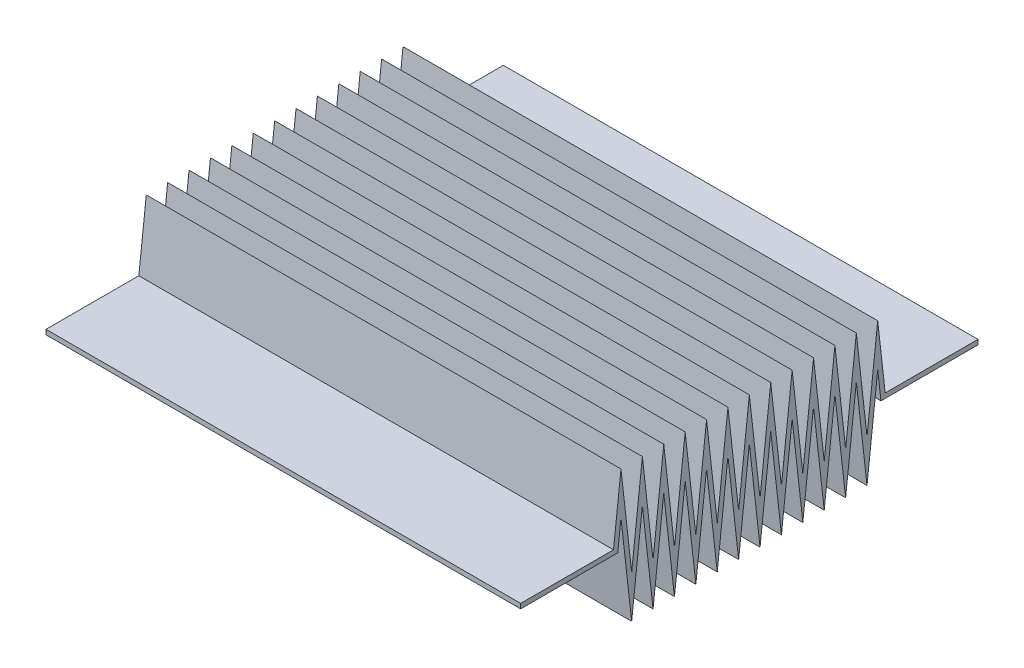
from build123d import *

# Parameters (mm, degrees)
EXTRUDE_THIN1_DEPTH = 25


with BuildPart() as part:
    # Sketch3 → Extrude-Thin1 (new, symmetric)
    with BuildSketch(Plane(origin=(0, 0, 0), x_dir=(0, 0, -1), z_dir=(1, 0, 0))):
        Polygon((0, 4.75), (10.223411929, 4.75), (10.563403677, 7.767301468), (11.69021103, -2.232698532), (12.817018383, 7.767301468), (13.943825736, -2.232698532), (15.070633089, 7.767301468), (16.197440443, -2.232698532), (17.324247796, 7.767301468), (18.451055149, -2.232698532), (19.577862502, 7.767301468), (20.704669856, -2.232698532), (21.831477209, 7.767301468), (22.958284562, -2.232698532), (24.085091915, 7.767301468), (25.211899268, -2.232698532), (26.338706622, 7.767301468), (27.465513975, -2.232698532), (28.592321328, 7.767301468), (29.719128681, -2.232698532), (30.845936035, 7.767301468), (31.972743388, -2.232698532), (33.099550741, 7.767301468), (34.226358094, -2.232698532), (35.353165447, 7.767301468), (36.479972801, -2.232698532), (37.606780154, 7.767301468), (37.946771902, 4.75), (48.170183831, 4.75), (48.170183831, 5.25), (38.393595759, 5.25), (37.606780154, 12.232698532), (36.479972801, 2.232698532), (35.353165447, 12.232698532), (34.226358094, 2.232698532), (33.099550741, 12.232698532), (31.972743388, 2.232698532), (30.845936035, 12.232698532), (29.719128681, 2.232698532), (28.592321328, 12.232698532), (27.465513975, 2.232698532), (26.338706622, 12.232698532), (25.211899268, 2.232698532), (24.085091915, 12.232698532), (22.958284562, 2.232698532), (21.831477209, 12.232698532), (20.704669856, 2.232698532), (19.577862502, 12.232698532), (18.451055149, 2.232698532), (17.324247796, 12.232698532), (16.197440443, 2.232698532), (15.070633089, 12.232698532), (13.943825736, 2.232698532), (12.817018383, 12.232698532), (11.69021103, 2.232698532), (10.563403677, 12.232698532), (9.776588071, 5.25), (0, 5.25), align=None)
    extrude(amount=EXTRUDE_THIN1_DEPTH, both=True)


solid = part.part
